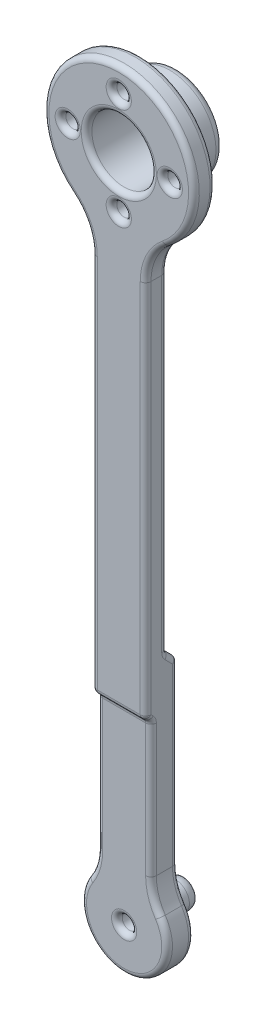
from build123d import *

# Parameters (mm, degrees)
BOSS_EXTRUDE1_DEPTH = 3
BOSS_EXTRUDE2_START = 2
BOSS_EXTRUDE2_DEPTH = 2
SKETCH3_W           = 10
SKETCH3_H           = 2
CUT_EXTRUDE1_DEPTH  = 66.923303169
BOSS_EXTRUDE3_DEPTH = 1
BOSS_EXTRUDE4_START = 2
SKETCH5_R           = 14
BOSS_EXTRUDE4_DEPTH = 2
SKETCH6_R           = 12.5
BOSS_EXTRUDE5_DEPTH = 4
DRAFT1_ANGLE        = 45
DRAFT2_ANGLE        = 45
SKETCH7_W           = 2
SKETCH7_H           = 0.5
HOLEWZD1_D          = 20
HOLEWZD2_D          = 3
HOLEWZD2_DEPTH      = 6.5
FILLET1_R           = 10
SKETCH12_R          = 2.65
BOSS_EXTRUDE6_DEPTH = 11
CUT_EXTRUDE2_START  = -4
SKETCH13_R          = 12.5
CUT_EXTRUDE2_DEPTH  = 4
SKETCH14_R          = 14
BOSS_EXTRUDE7_DEPTH = 6
SKETCH15_R          = 8.6
BOSS_EXTRUDE8_DEPTH = 5
FILLET2_R           = 1.5
SKETCH16_R          = 14
SKETCH16_R_2        = 10.1
CUT_EXTRUDE3_DEPTH  = 2
SKETCH18_R          = 6
CUT_EXTRUDE4_DEPTH  = 207.489709187
SKETCH19_R          = 1.35
CUT_EXTRUDE5_DEPTH  = 3
FILLET3_SIZE        = 1.5
FILLET3_SIZE_2      = 0.5
SKETCH21_R          = 1.35
CUT_EXTRUDE8_DEPTH  = 207.545394526
FILLET5_R           = 1
BOSS_EXTRUDE9_START = 1.3
SKETCH22_R          = 3.45
SKETCH22_R_2        = 1.35
BOSS_EXTRUDE9_DEPTH = 1.3
FILLET6_R           = 1


with BuildPart() as part:
    # Sketch1 → Boss-Extrude1 (new body)
    with BuildSketch(Plane(origin=(0, 0, 7.5), x_dir=(-1, 0, 0), z_dir=(0, 0, -1))):
        with BuildLine():
            Line((-45, 171.923303169), (-45, 66.244997998))
            ThreePointArc((-45, 66.244997998), (-40, 52), (-35, 66.244997998))
            Line((-35, 66.244997998), (-35, 171.923303169))
            ThreePointArc((-35, 171.923303169), (-40, 199), (-45, 171.923303169))
        make_face()
    extrude(amount=-BOSS_EXTRUDE1_DEPTH)

    # Sketch2 → Boss-Extrude2 (add)
    with BuildSketch(Plane(origin=(0, 0, 7.5), x_dir=(-1, 0, 0), z_dir=(0, 0, -1)).offset(BOSS_EXTRUDE2_START)):
        with BuildLine():
            Line((-45, 66.244997998), (-45, 171.923303169))
            Line((-45, 171.923303169), (-35, 171.923303169))
            Line((-35, 171.923303169), (-35, 66.244997998))
            ThreePointArc((-35, 66.244997998), (-40, 52), (-45, 66.244997998))
        make_face()
    extrude(amount=-BOSS_EXTRUDE2_DEPTH)

    # Sketch3 → Cut-Extrude1 (cut)
    with BuildSketch(Plane(origin=(0, 171.923303169, 0), x_dir=(-1, 0, 0), z_dir=(0, 1, 0))):
        with Locations((-40, 6.5)):
            Rectangle(SKETCH3_W, SKETCH3_H)
    extrude(amount=-CUT_EXTRUDE1_DEPTH, mode=Mode.SUBTRACT)

    # Sketch4 → Boss-Extrude3 (add)
    with BuildSketch(Plane.XY.offset(10.5)):
        with BuildLine():
            Line((35, 96), (35, 171.923303169))
            ThreePointArc((35, 171.923303169), (40, 199), (45, 171.923303169))
            Line((45, 171.923303169), (45, 96))
            Line((45, 96), (35, 96))
        make_face()
    extrude(amount=BOSS_EXTRUDE3_DEPTH)

    # Sketch5 → Boss-Extrude4 (add)
    with BuildSketch(Plane(origin=(0, 0, 7.5), x_dir=(-1, 0, 0), z_dir=(0, 0, -1)).offset(BOSS_EXTRUDE4_START)):
        with Locations((-40, 185)):
            Circle(SKETCH5_R)
    extrude(amount=-BOSS_EXTRUDE4_DEPTH)

    # Sketch6 → Boss-Extrude5 (add)
    with BuildSketch(Plane(origin=(0, 0, 5.5), x_dir=(-1, 0, 0), z_dir=(0, 0, -1))):
        with Locations((-40, 185)):
            Circle(SKETCH6_R)
    extrude(amount=BOSS_EXTRUDE5_DEPTH)

    # Draft1
    draft1_faces = [part.faces().sort_by_distance(p)[0] for p in [
        (40, 96, 11),
    ]]
    draft(draft1_faces, Plane(origin=(40, 185, 11.5), x_dir=(1, 0, 0), z_dir=(0, 0, 1)), DRAFT1_ANGLE)

    # Draft2
    draft2_faces = [part.faces().sort_by_distance(p)[0] for p in [
        (40, 105, 6.5),
    ]]
    draft(draft2_faces, Plane(origin=(40, 185, 7.5), x_dir=(-1, 0, 0), z_dir=(0, 0, -1)), DRAFT2_ANGLE)

    # Sketch7 → Revolve1 (revolve)
    with BuildSketch(Plane.XZ.offset(-60), mode=Mode.PRIVATE) as revolve1_sk:
        with Locations((41, 5.25)):
            Rectangle(SKETCH7_W, SKETCH7_H)
    revolve(revolve1_sk.sketch.rotate(Axis((40, 60, 5.5), (0, 0, -1)), 180), axis=Axis((40, 60, 5.5), (0, 0, -1)))

    # HoleWzd1 (through all)
    with Locations(Plane.XY.offset(11.5)):
        with Locations((40, 185)):
            Hole(HOLEWZD1_D / 2)

    # HoleWzd2
    with Locations(Plane(origin=(0, 0, 5), x_dir=(-1, 0, 0), z_dir=(0, 0, -1))):
        with Locations((-40, 60)):
            Hole(HOLEWZD2_D / 2, depth=HOLEWZD2_DEPTH)

    # Fillet1
    # the kernel refuses this fillet: 10 mm, written as the material it adds along each edge
    with BuildSketch(Plane(origin=(35, 171.923303169, 7.5), x_dir=(-0.8677350071061872, 0.49702711942350297, 0), z_dir=(0, 0, 1))) as fillet1_piece_1:
        with BuildLine():
            CenterArc((5.865022931, 9.880173725), FILLET1_R, 209.803509941, 51.317812547)
            Line((-2.812327141, 4.90990253), (0, 0))
            ThreePointArc((0, 0), (2.160797922, 0.167756786), (4.321595844, 0))
        make_face()
    extrude(amount=3)
    with BuildSketch(Plane(origin=(35, 66.244997998, 7.5), x_dir=(-0.6747863487276905, -0.7380131323836668, 0), z_dir=(0, 0, 1))) as fillet1_piece_2:
        with BuildLine():
            CenterArc((4.01361607, -9.880131324), FILLET1_R, 98.880251392, 33.557309762)
            Line((-2.734247417, -2.5), (0, 0))
            ThreePointArc((0, 0), (1.234958791, -0.095894941), (2.469917582, 0))
        make_face()
    extrude(amount=3)
    with BuildSketch(Plane(origin=(45, 66.244997998, 7.5), x_dir=(0, 1, 0), z_dir=(0, 0, 1))) as fillet1_piece_3:
        with BuildLine():
            CenterArc((3.704876373, -10), FILLET1_R, 90, 33.557309762)
            ThreePointArc((-1.822831611, -1.666666667), (-0.846707209, -0.904105059), (0, 0))
            Line((0, 0), (3.704876373, 0))
        make_face()
    extrude(amount=3)
    with BuildSketch(Plane(origin=(45, 171.923303169, 7.5), x_dir=(0, -1, 0), z_dir=(0, 0, 1))) as fillet1_piece_4:
        with BuildLine():
            CenterArc((5.658297165, 10), FILLET1_R, 218.682187453, 51.317812547)
            ThreePointArc((-2.147950333, 3.75), (-0.928406731, 1.958379672), (0, 0))
            Line((0, 0), (5.658297165, 0))
        make_face()
    extrude(amount=4)
    with BuildSketch(Plane(origin=(45, 66.244997998, 5.5), x_dir=(0, 1, 0), z_dir=(0, 0, 1))) as fillet1_piece_5:
        with BuildLine():
            CenterArc((3.704876373, -10), FILLET1_R, 90, 33.557309762)
            ThreePointArc((-1.822831611, -1.666666667), (-0.846707209, -0.904105059), (0, 0))
            Line((0, 0), (3.704876373, 0))
        make_face()
    extrude(amount=2)
    with BuildSketch(Plane(origin=(35, 66.244997998, 5.5), x_dir=(-0.6747863487276905, -0.7380131323836668, 0), z_dir=(0, 0, 1))) as fillet1_piece_6:
        with BuildLine():
            CenterArc((4.01361607, -9.880131324), FILLET1_R, 98.880251392, 33.557309762)
            Line((-2.734247417, -2.5), (0, 0))
            ThreePointArc((0, 0), (1.234958791, -0.095894941), (2.469917582, 0))
        make_face()
    extrude(amount=2)
    with BuildSketch(Plane(origin=(35, 171.923303169, 10.5), x_dir=(-0.8677350071061872, 0.49702711942350297, 0), z_dir=(0, 0, 1))) as fillet1_piece_7:
        with BuildLine():
            CenterArc((5.865022931, 9.880173725), FILLET1_R, 209.803509941, 51.317812547)
            Line((-2.812327141, 4.90990253), (0, 0))
            ThreePointArc((0, 0), (2.160797922, 0.167756786), (4.321595844, 0))
        make_face()
    extrude(amount=1)

    # Sketch12 → Boss-Extrude6 (add)
    with BuildSketch(Plane.XY.offset(10.5)):
        with Locations((40, 60)):
            Circle(SKETCH12_R)
    extrude(amount=-BOSS_EXTRUDE6_DEPTH)

    # Sketch13 → Cut-Extrude2 (cut)
    with BuildSketch(Plane(origin=(0, 0, 1.5), x_dir=(-1, 0, 0), z_dir=(0, 0, -1)).offset(CUT_EXTRUDE2_START)):
        with Locations((-40, 185)):
            Circle(SKETCH13_R)
    extrude(amount=CUT_EXTRUDE2_DEPTH, mode=Mode.SUBTRACT)

    # Sketch14 → Boss-Extrude7 (add)
    with BuildSketch(Plane(origin=(0, 0, 5.5), x_dir=(-1, 0, 0), z_dir=(0, 0, -1))):
        with Locations((-40, 185)):
            Circle(SKETCH14_R)
    extrude(amount=-BOSS_EXTRUDE7_DEPTH)

    # Sketch15 → Boss-Extrude8 (add)
    with BuildSketch(Plane(origin=(0, 0, 5.5), x_dir=(-1, 0, 0), z_dir=(0, 0, -1))):
        with Locations((-40, 185)):
            Circle(SKETCH15_R)
    extrude(amount=BOSS_EXTRUDE8_DEPTH)

    # Fillet2
    fillet2_edges = [part.edges().sort_by_distance(p)[0] for p in [
        (48.6, 185, 0.5),
    ]]
    fillet(fillet2_edges, radius=FILLET2_R)

    # Sketch16 → Cut-Extrude3 (cut)
    with BuildSketch(Plane(origin=(0, 0, 5.5), x_dir=(-1, 0, 0), z_dir=(0, 0, -1))):
        with Locations((-40, 185)):
            Circle(SKETCH16_R)
        with Locations((-40, 185)):
            Circle(SKETCH16_R_2, mode=Mode.SUBTRACT)
    extrude(amount=-CUT_EXTRUDE3_DEPTH, mode=Mode.SUBTRACT)

    # Sketch18 → Cut-Extrude4 (cut, through all)
    with BuildSketch(Plane(origin=(0, 0, 0.5), x_dir=(-1, 0, 0), z_dir=(0, 0, -1))):
        with Locations((-40, 185)):
            Circle(SKETCH18_R)
    extrude(amount=-CUT_EXTRUDE4_DEPTH, mode=Mode.SUBTRACT)

    # Sketch19 → Cut-Extrude5 (cut)
    with BuildSketch(Plane.XY.offset(11.5)):
        with Locations((40, 194.5)):
            Circle(SKETCH19_R)
        with Locations((49.5, 185)):
            Circle(SKETCH19_R)
        with Locations((30.5, 185)):
            Circle(SKETCH19_R)
        with Locations((40, 175.5)):
            Circle(SKETCH19_R)
    extrude(amount=-CUT_EXTRUDE5_DEPTH, mode=Mode.SUBTRACT)

    # Fillet3
    # an asymmetric fillet: 1.5, 0.5 mm, written as the material it takes off along each edge
    with BuildSketch(Plane(origin=(40, 60, -0.5), x_dir=(1, 0, 0), z_dir=(0, -1, 0))) as fillet3_piece_1:
        with BuildLine():
            Bezier((2.65, FILLET3_SIZE), (2.65, 0), (2.65 - FILLET3_SIZE_2, 0), weights=[1, 0.707106781, 1])
            Line((2.65 - FILLET3_SIZE_2, 0), (2.65, 0))
            Line((2.65, 0), (2.65, FILLET3_SIZE))
        make_face()
    revolve(axis=Axis((40, 60, -0.5), (0, 0, 1)), mode=Mode.SUBTRACT)

    # Sketch21 → Cut-Extrude8 (cut, through all)
    with BuildSketch(Plane(origin=(0, 0, -0.5), x_dir=(-1, 0, 0), z_dir=(0, 0, -1))):
        with Locations((-40, 60)):
            Circle(SKETCH21_R)
    extrude(amount=-CUT_EXTRUDE8_DEPTH, mode=Mode.SUBTRACT)

    # Fillet5
    fillet5_edges = [part.edges().sort_by_distance(p)[0] for p in [
        (41.35, 60, 10.5),
    ]]
    fillet(fillet5_edges, radius=FILLET5_R)

    # Sketch22 → Boss-Extrude9 (add)
    with BuildSketch(Plane(origin=(0, 0, 5.5), x_dir=(-1, 0, 0), z_dir=(0, 0, -1)).offset(BOSS_EXTRUDE9_START)):
        with Locations(Location((-40, 60, 0), (0, 0, 180))):
            Circle(SKETCH22_R)
        with Locations((-40, 60)):
            Circle(SKETCH22_R_2, mode=Mode.SUBTRACT)
    extrude(amount=-BOSS_EXTRUDE9_DEPTH)

    # Fillet6
    fillet6_edges = [part.edges().sort_by_distance(p)[0] for p in [
        (45, 95.5, 11),
        (35, 95.5, 11),
        (35, 104, 6.5),
        (45, 104, 6.5),
        (35, 86.474937186, 5.5),
        (34.574271078, 67.063123025, 5.5),
        (40, 52, 5.5),
        (45.425728922, 67.063123025, 5.5),
        (45, 86.474937186, 5.5),
        (40, 103, 5.5),
        (45, 131.132503002, 11.5),
        (40, 96, 11.5),
        (35, 131.132503002, 11.5),
        (34.013878189, 170.595133024, 11.5),
        (40, 199, 11.5),
        (45.986121811, 170.595133024, 11.5),
        (46, 185, 11.5),
        (38.65, 175.5, 11.5),
        (29.15, 185, 11.5),
        (48.15, 185, 11.5),
        (38.65, 194.5, 11.5),
        (45, 82.474937186, 10.5),
        (45.425728922, 67.063123025, 10.5),
        (40, 52, 10.5),
        (34.574271078, 67.063123025, 10.5),
        (35, 82.474937186, 10.5),
        (40, 95, 10.5),
        (50.1, 185, 7.5),
        (40, 105, 7.5),
        (45, 135.632503002, 7.5),
        (45.986121811, 170.595133024, 7.5),
        (40, 199, 7.5),
        (34.013878189, 170.595133024, 7.5),
        (35, 135.632503002, 7.5),
        (36.55, 60, 5.5),
    ]]
    fillet(fillet6_edges, radius=FILLET6_R)


solid = part.part
